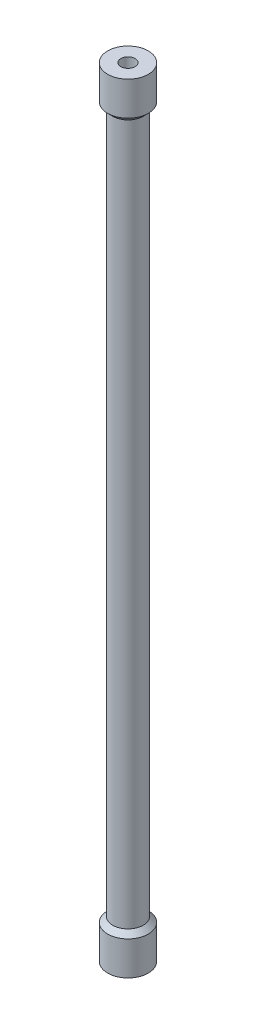
from build123d import *

# Parameters (mm, degrees)
SKETCH_1_R      = 6
EXTRUDE_1_DEPTH = 115
SKETCH_2_W      = 1.5
SKETCH_2_H      = 210
CHAMFER_1_SIZE  = 1.5


with BuildPart() as part:
    # 草图1 → 凸台-拉伸1 (new, symmetric)
    with BuildSketch(Plane(origin=(0, 0, 0), x_dir=(1, 0, 0), z_dir=(0, 1, 0))):
        with Locations(Location((0, 0, 0), (0, 0, 270))):
            Circle(SKETCH_1_R)
    extrude(amount=EXTRUDE_1_DEPTH, both=True)

    # 草图2 → 切除-旋转1 (revolve, cut)
    with BuildSketch(Plane.XY, mode=Mode.PRIVATE) as cut_revolve_1_sk:
        with Locations((5.25, 0)):
            Rectangle(SKETCH_2_W, SKETCH_2_H)
    revolve(cut_revolve_1_sk.sketch.rotate(Axis((0, 115, 0), (0, -1, 0)), 90), axis=Axis((0, 115, 0), (0, -1, 0)), mode=Mode.SUBTRACT)

    # 倒角1
    chamfer_1_edges = [part.edges().sort_by_distance(p)[0] for p in [
        (0, 105, -4.5),
        (0, -105, -4.5),
    ]]
    chamfer(chamfer_1_edges, length=CHAMFER_1_SIZE - 0.0001)  # a hair under: the kernel refuses the full size

    # 草图3 → M5 螺纹孔1 (revolve, cut)
    with BuildSketch(Plane(origin=(0, -115, 0), x_dir=(0, 0, -1), z_dir=(1, 0, 0))):
        Polygon((0, 0), (0, 18.6618073), (2.1, 17.4), (2.1, 0), align=None)
    hole_wizard_m5_1 = revolve(axis=Axis((0, -121.35, 0), (0, 1, 0)), mode=Mode.SUBTRACT)

    # 镜向1: M5 螺纹孔1 across plane
    add(hole_wizard_m5_1.mirror(Plane.ZX), mode=Mode.SUBTRACT)


solid = part.part
